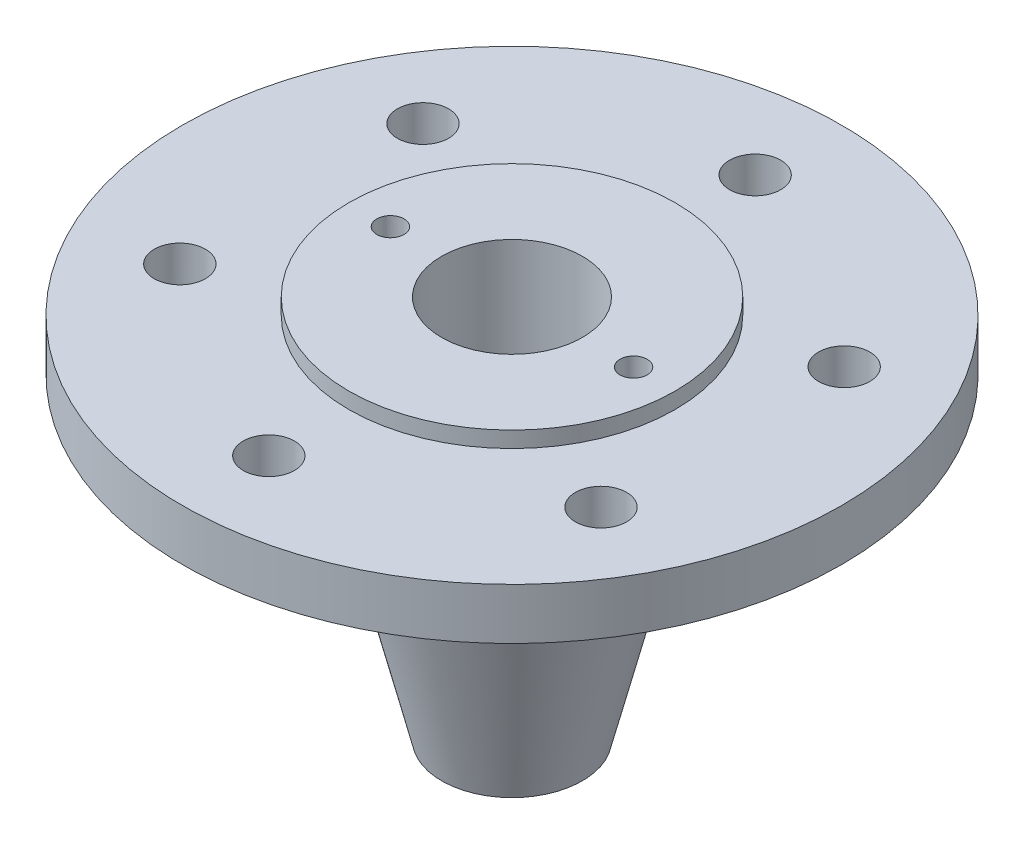
from build123d import *

# Parameters (mm, degrees)
FILLET1_R                 = 5
F_1_0_16_DIAMETER_HOLE1_D = 16
CIRPATTERN1_COUNT         = 6
M10X1_5_TAPPED_HOLE1_D    = 8.5


# Read off the part's stored shape, not the designer's step: Cut-Revolve-Thin1
with BuildPart() as part:
    # Sketch1 → Revolve1 (revolve)
    with BuildSketch(Plane.XY, mode=Mode.PRIVATE) as revolve1_sk:
        Polygon((0, 0), (51, 0), (51, -5), (103, -5), (103, -21), (54, -21), (54, -31), (44, -31), (22, -120), (0, -120), align=None)
    revolve(revolve1_sk.sketch.rotate(Axis((0, 0, 0), (0, -1, 0)), 180), axis=Axis((0, 0, 0), (0, -1, 0)))

    # Cut-Revolve-Thin1 outline → Cut-Revolve-Thin1 (revolve, cut)
    with BuildSketch(Plane.XY):
        Polygon((0, -120), (11.75, -120), (11.75, -82), (16, -79.240017729), (16, -65.247037966), (11, -62), (11, -51.143483525), (22, -44), (22, 0), (0, 0), align=None)
    revolve(axis=Axis((0, 0, 0), (0, 1, 0)), mode=Mode.SUBTRACT)

    # Fillet1
    fillet1_edges = [part.edges().sort_by_distance(p)[0] for p in [
        (44, -31, 0),
    ]]
    fillet(fillet1_edges, radius=FILLET1_R)

    # Ø1.0 (16) Diameter Hole1 (through all)
    with Locations(Plane(origin=(0, -5, 0), x_dir=(1, 0, 0), z_dir=(0, 1, 0))):
        with Locations((0, 76)):
            f_1_0_16_diameter_hole1 = Hole(F_1_0_16_DIAMETER_HOLE1_D / 2)

    # CirPattern1: Ø1.0 (16) Diameter Hole1 ×6 about axis
    cirpattern1_axis = Axis((0, 0, 0), (0, 1, 0))
    for i in range(1, CIRPATTERN1_COUNT):
        add(f_1_0_16_diameter_hole1.rotate(cirpattern1_axis, i * 360 / CIRPATTERN1_COUNT), mode=Mode.SUBTRACT)

    # M10x1.5 Tapped Hole1 (through all)
    with Locations(Plane(origin=(0, 0, 0), x_dir=(1, 0, 0), z_dir=(0, 1, 0))):
        with Locations((38, 0), (-38, 0)):
            Hole(M10X1_5_TAPPED_HOLE1_D / 2)


solid = part.part
